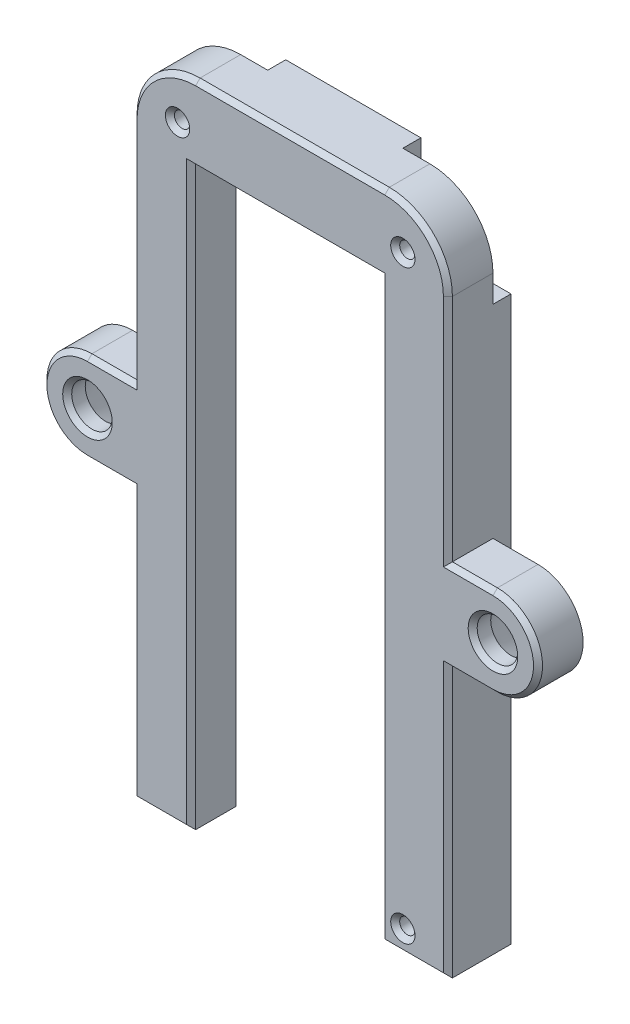
from build123d import *
from OCP.BRepFilletAPI import BRepFilletAPI_MakeChamfer

# Parameters (mm, degrees)
SKETCH1_R           = 0.85
BOSS_EXTRUDE1_DEPTH = 5
BOSS_EXTRUDE2_DEPTH = 2
SKETCH3_R           = 2.25
BOSS_EXTRUDE3_DEPTH = 5
SKETCH4_R           = 3.5
CUT_EXTRUDE1_DEPTH  = 3
SKETCH5_W           = 10
SKETCH5_H           = 10
CUT_EXTRUDE2_DEPTH  = 47.770717335
FILLET1_R           = 7
CHAMFER3_SIZE       = 0.5
CHAMFER1_SIZE       = 2.5
CHAMFER1_SIZE_2     = 1.25


with BuildPart() as part:
    # Sketch1 → Boss-Extrude1 (new body)
    with BuildSketch(Plane.XY):
        Polygon((-11, -35), (-11, 29), (10, 29), (10, -35), (17.5, -35), (17.5, 37.5), (-17.5, 37.5), (-17.5, -35), align=None)
        with Locations((-12.5, 32.5)):
            Circle(SKETCH1_R, mode=Mode.SUBTRACT)
        with Locations((12.5, 32.5)):
            Circle(SKETCH1_R, mode=Mode.SUBTRACT)
        with Locations((12.5, -32.5)):
            Circle(SKETCH1_R, mode=Mode.SUBTRACT)
    extrude(amount=BOSS_EXTRUDE1_DEPTH)

    # Sketch2 → Boss-Extrude2 (add)
    with BuildSketch(Plane.XY):
        Polygon((17.5, -35), (17.5, 37.5), (-17.5, 37.5), (-17.5, -35), (-15.1, -35), (-15.1, 35.1), (15.1, 35.1), (15.1, -35), align=None)
    extrude(amount=-BOSS_EXTRUDE2_DEPTH)

    # Sketch3 → Boss-Extrude3 (add)
    # profile 1 of 2: a face of its own
    with BuildSketch(Plane.XY):
        with BuildLine():
            Line((22.5, 5), (17.5, 5))
            Line((17.5, 5), (17.5, -5))
            Line((17.5, -5), (22.5, -5))
            ThreePointArc((22.5, -5), (27.5, 0), (22.5, 5))
        make_face()
        with Locations(Location((22.5, 0, 0), (0, 0, 180))):
            Circle(SKETCH3_R, mode=Mode.SUBTRACT)
    # profile 2 of 2: a face of its own
    with BuildSketch(Plane.XY):
        with BuildLine():
            Line((-22.5, 5), (-17.5, 5))
            Line((-17.5, 5), (-17.5, -5))
            Line((-17.5, -5), (-22.5, -5))
            ThreePointArc((-22.5, -5), (-27.5, 0), (-22.5, 5))
        make_face()
        with Locations(Location((-22.5, 0, 0), (0, 0, 180))):
            Circle(SKETCH3_R, mode=Mode.SUBTRACT)
    extrude(amount=BOSS_EXTRUDE3_DEPTH)

    # Sketch4 → Cut-Extrude1 (cut)
    with BuildSketch(Plane(origin=(0, 0, 0), x_dir=(-1, 0, 0), z_dir=(0, 0, -1))):
        with Locations((-22.5, 0)):
            Circle(SKETCH4_R)
        with Locations((22.5, 0)):
            Circle(SKETCH4_R)
    extrude(amount=-CUT_EXTRUDE1_DEPTH, mode=Mode.SUBTRACT)

    # Sketch5 → Cut-Extrude2 (cut, through all)
    with BuildSketch(Plane(origin=(0, 0, 0), x_dir=(-1, 0, 0), z_dir=(0, 0, -1))):
        with Locations((-12.5, 32.5)):
            Rectangle(SKETCH5_W, SKETCH5_H)
        with Locations((12.5, 32.5)):
            Rectangle(SKETCH5_W, SKETCH5_H)
    extrude(amount=CUT_EXTRUDE2_DEPTH, mode=Mode.SUBTRACT)

    # Fillet1
    fillet1_edges = [part.edges().sort_by_distance(p)[0] for p in [
        (-17.5, 37.5, 2.5),
        (17.5, 37.5, 2.5),
    ]]
    fillet(fillet1_edges, radius=FILLET1_R)

    # Chamfer3
    chamfer3_edges = [part.edges().sort_by_distance(p)[0] for p in [
        (-0.5, 29, 5),
        (-17.5, 17.75, 5),
        (0, 37.5, 5),
        (15.449747468, 35.449747468, 5),
        (-15.449747468, 35.449747468, 5),
        (10, -3, 5),
        (13.75, -35, 5),
        (-13.35, 32.5, 0),
        (-13.35, 32.5, 5),
        (17.5, -20, 5),
        (11.65, 32.5, 0),
        (11.65, 32.5, 5),
        (11.65, -32.5, 0),
        (11.65, -32.5, 5),
        (-14.25, -35, 5),
        (17.5, 17.75, 5),
        (27.5, 0, 5),
        (20, 5, 5),
        (20, -5, 5),
        (24.75, 0, 5),
        (-17.5, -20, 5),
        (-27.5, 0, 5),
        (-20, -5, 5),
        (-20, 5, 5),
        (-20.25, 0, 5),
        (-11, -3, 5),
    ]]
    chamfer(chamfer3_edges, length=CHAMFER3_SIZE)

    # Chamfer1
    chamfer1_edges_1 = [part.edges().sort_by_distance(p)[0] for p in [
        (26, 0, 3),
    ]]
    chamfer1_side_1 = [part.faces().sort_by_distance(p)[0] for p in [
        (26, 0, 2.975),
    ]]
    chamfer1_edges_2 = [part.edges().sort_by_distance(p)[0] for p in [
        (-19, 0, 3),
    ]]
    chamfer1_side_2 = [part.faces().sort_by_distance(p)[0] for p in [
        (-19, 0, 2.975),
    ]]
    chamfer1 = BRepFilletAPI_MakeChamfer(part.part.solid().wrapped)
    for e in chamfer1_edges_1:
        chamfer1.Add(CHAMFER1_SIZE - 0.0001, CHAMFER1_SIZE_2 - 0.0001, e.wrapped, chamfer1_side_1[0].wrapped)
    for e in chamfer1_edges_2:
        chamfer1.Add(CHAMFER1_SIZE - 0.0001, CHAMFER1_SIZE_2 - 0.0001, e.wrapped, chamfer1_side_2[0].wrapped)
    add(Compound.cast(chamfer1.Shape()), mode=Mode.REPLACE)  # a hair under: the kernel refuses the full size


solid = part.part
